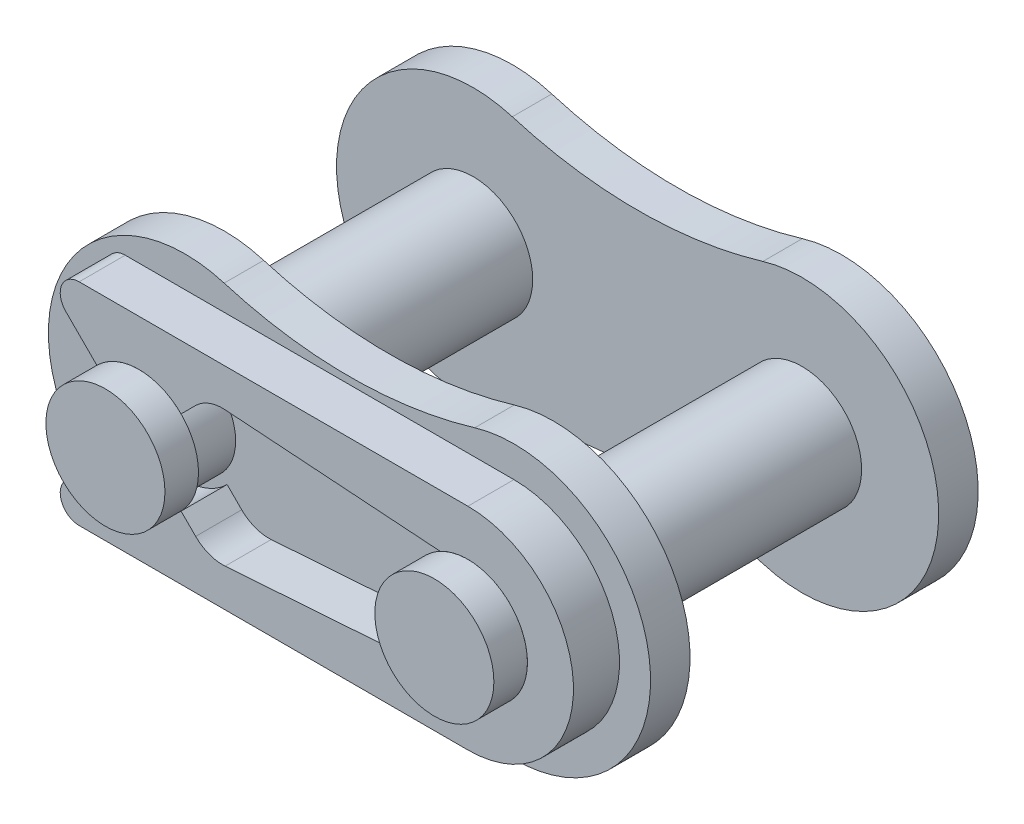
from build123d import *

# Parameters (mm, degrees)
SKETCH4_R                  = 1.651
SKETCH4_R_2                = 1.17475
BOSS_EXTRUDE1_DEPTH        = 1.5875
SKETCH5_R                  = 1.14935
BOSS_EXTRUDE2_DEPTH        = 0.762
LPATTERN1_COUNT            = 2
LPATTERN1_PITCH            = 6.35
SKETCH7_R                  = 1.14935
BOSS_EXTRUDE3_DEPTH        = 0.762
MIRROR1_START              = 2.4003
MIRROR1_OUTLINE_R          = 1.14935
MIRROR1_DEPTH              = 0.762
BOSS_EXTRUDE4_DEPTH        = 4.699
BOSS_EXTRUDE4_DEPTH_BACK   = 3.81
SKETCH8_R                  = 1.14935
BOSS_EXTRUDE4_2_DEPTH      = 4.699
BOSS_EXTRUDE4_2_DEPTH_BACK = 3.81
BOSS_EXTRUDE5_DEPTH        = 0.889
SKETCH12_R                 = 1.14935
SKETCH12_R_2               = 0.9769475
CUT_EXTRUDE1_DEPTH         = 0.889


# Read off the part's stored shape, not the designer's step: Mirror1
with BuildPart() as part:
    # Sketch4 → Boss-Extrude1 (new, symmetric)
    with BuildSketch(Plane.XY):
        with Locations((3.175, 0)):
            Circle(SKETCH4_R)
        with Locations((3.175, 0)):
            Circle(SKETCH4_R_2, mode=Mode.SUBTRACT)
    extrude(amount=BOSS_EXTRUDE1_DEPTH, both=True)


with BuildPart() as body_2:
    # Sketch5 → Boss-Extrude2 (new body)
    with BuildSketch(Plane.XY.offset(1.5875)):
        with BuildLine():
            ThreePointArc((-2.342877482, 2.879371452), (-6.1722, 0), (-2.342877482, -2.879371452))
            ThreePointArc((-2.342877482, -2.879371452), (0, -2.54762), (2.342877482, -2.879371452))
            ThreePointArc((2.342877482, -2.879371452), (6.1722, 0), (2.342877482, 2.879371452))
            ThreePointArc((2.342877482, 2.879371452), (0, 2.54762), (-2.342877482, 2.879371452))
        make_face()
        with Locations(Location((-3.175, 0, 0), (0, 0, 180))):
            Circle(SKETCH5_R, mode=Mode.SUBTRACT)
        with Locations(Location((3.175, 0, 0), (0, 0, 180))):
            Circle(SKETCH5_R, mode=Mode.SUBTRACT)
    extrude(amount=BOSS_EXTRUDE2_DEPTH)


with BuildPart() as lpattern1_1:
    # LPattern1: pattern copy
    add(part.part.moved(Location(Vector(1, 0, 0) * (1 * LPATTERN1_PITCH))))


with BuildPart() as body_4:
    # Sketch7 → Boss-Extrude3 (new body)
    with BuildSketch(Plane.XY.offset(-2.4003)):
        with BuildLine():
            ThreePointArc((3.931045679, 2.526853989), (0.537464, 0), (3.931045679, -2.526853989))
            ThreePointArc((3.931045679, -2.526853989), (6.35, -2.17272892), (8.768954321, -2.526853989))
            ThreePointArc((8.768954321, -2.526853989), (12.162536, 0), (8.768954321, 2.526853989))
            ThreePointArc((8.768954321, 2.526853989), (6.35, 2.17272892), (3.931045679, 2.526853989))
        make_face()
        with Locations((3.175, 0)):
            Circle(SKETCH7_R, mode=Mode.SUBTRACT)
        with Locations((9.525, 0)):
            Circle(SKETCH7_R, mode=Mode.SUBTRACT)
    extrude(amount=-BOSS_EXTRUDE3_DEPTH)


with BuildPart() as body_5:
    # Mirror1 outline → Mirror1 (new body)
    with BuildSketch(Plane.XY.offset(MIRROR1_START)):
        with BuildLine():
            ThreePointArc((8.768954321, -2.526853989), (12.162536, 0), (8.768954321, 2.526853989))
            ThreePointArc((8.768954321, 2.526853989), (6.35, 2.17272892), (3.931045679, 2.526853989))
            ThreePointArc((3.931045679, 2.526853989), (0.537464, 0), (3.931045679, -2.526853989))
            ThreePointArc((3.931045679, -2.526853989), (6.35, -2.17272892), (8.768954321, -2.526853989))
        make_face()
        with Locations((3.175, 0)):
            Circle(MIRROR1_OUTLINE_R, mode=Mode.SUBTRACT)
        with Locations((9.525, 0)):
            Circle(MIRROR1_OUTLINE_R, mode=Mode.SUBTRACT)
    extrude(amount=MIRROR1_DEPTH)


with BuildPart() as body_3:
    # Sketch8 → Boss-Extrude4 (new, two sides: drawn at the far end of the back side and taken through both)
    with BuildSketch(Plane.XY.offset(-BOSS_EXTRUDE4_DEPTH_BACK)):
        with Locations((3.175, 0)):
            Circle(SKETCH8_R)
    extrude(amount=BOSS_EXTRUDE4_DEPTH + BOSS_EXTRUDE4_DEPTH_BACK)


with BuildPart() as body_4_2:
    # Sketch8 → Boss-Extrude4 2 (new, two sides: drawn at the far end of the back side and taken through both)
    with BuildSketch(Plane.XY.offset(-BOSS_EXTRUDE4_2_DEPTH_BACK)):
        with Locations((9.525, 0)):
            Circle(SKETCH8_R)
    extrude(amount=BOSS_EXTRUDE4_2_DEPTH + BOSS_EXTRUDE4_2_DEPTH_BACK)


with BuildPart() as body_5_2:
    # Sketch10 → Boss-Extrude5 (new body)
    with BuildSketch(Plane.XY.offset(3.1623)):
        with BuildLine():
            Line((9.525, -2.038096), (2.020925445, -2.038096))
            ThreePointArc((2.020925445, -2.038096), (1.682446393, -1.811912533), (1.761913324, -1.412648164))
            Line((1.761913324, -1.412648164), (2.484086603, -0.690698991))
            ThreePointArc((2.484086603, -0.690698991), (3.175, -0.9769475), (3.865913397, -0.690698991))
            Line((3.865913397, -0.690698991), (4.269428301, -1.094213895))
            ThreePointArc((4.269428301, -1.094213895), (4.530932284, -1.262418909), (4.838644263, -1.307035023))
            Line((4.838644263, -1.307035023), (9.593148413, -0.974567705))
            ThreePointArc((9.593148413, -0.974567705), (10.5019475, 0), (9.593148413, 0.974567705))
            Line((9.593148413, 0.974567705), (4.838644263, 1.307035023))
            ThreePointArc((4.838644263, 1.307035023), (4.530932284, 1.262418909), (4.269428301, 1.094213895))
            Line((4.269428301, 1.094213895), (3.865913397, 0.690698991))
            ThreePointArc((3.865913397, 0.690698991), (3.175, 0.9769475), (2.484086603, 0.690698991))
            Line((2.484086603, 0.690698991), (1.761913324, 1.412648164))
            ThreePointArc((1.761913324, 1.412648164), (1.682446393, 1.811912533), (2.020925445, 2.038096))
            Line((2.020925445, 2.038096), (9.525, 2.038096))
            ThreePointArc((9.525, 2.038096), (11.563096, 0), (9.525, -2.038096))
        make_face()
    extrude(amount=BOSS_EXTRUDE5_DEPTH)


with BuildPart() as cut_extrude1_tool:
    # Sketch12 → Cut-Extrude1 (new body)
    # profile 1 of 2: a face of its own
    with BuildSketch(Plane.XY.offset(3.1623)):
        with Locations((3.175, 0)):
            Circle(SKETCH12_R)
        with Locations((3.175, 0)):
            Circle(SKETCH12_R_2, mode=Mode.SUBTRACT)
    # profile 2 of 2: a face of its own
    with BuildSketch(Plane.XY.offset(3.1623)):
        with Locations((9.525, 0)):
            Circle(SKETCH12_R)
        with Locations((9.525, 0)):
            Circle(SKETCH12_R_2, mode=Mode.SUBTRACT)
    extrude(amount=CUT_EXTRUDE1_DEPTH)


with BuildPart() as body_3_1:
    add(body_3.part)

    # Cut-Extrude1: cut by cut_extrude1_tool
    add(cut_extrude1_tool.part, mode=Mode.SUBTRACT)


with BuildPart() as body_4_2_1:
    add(body_4_2.part)

    # Cut-Extrude1: cut by cut_extrude1_tool
    add(cut_extrude1_tool.part, mode=Mode.SUBTRACT)


with BuildPart() as body_5_2_1:
    add(body_5_2.part)

    # Cut-Extrude1: cut by cut_extrude1_tool
    add(cut_extrude1_tool.part, mode=Mode.SUBTRACT)


with BuildPart() as body_4_1:
    add(body_4.part)

    # Combine3: union body 5, body 4 2, body 3
    add(body_5.part)
    add(body_4_2_1.part)
    add(body_3_1.part)


solid = Compound([body_5_2_1.part, body_4_1.part])
